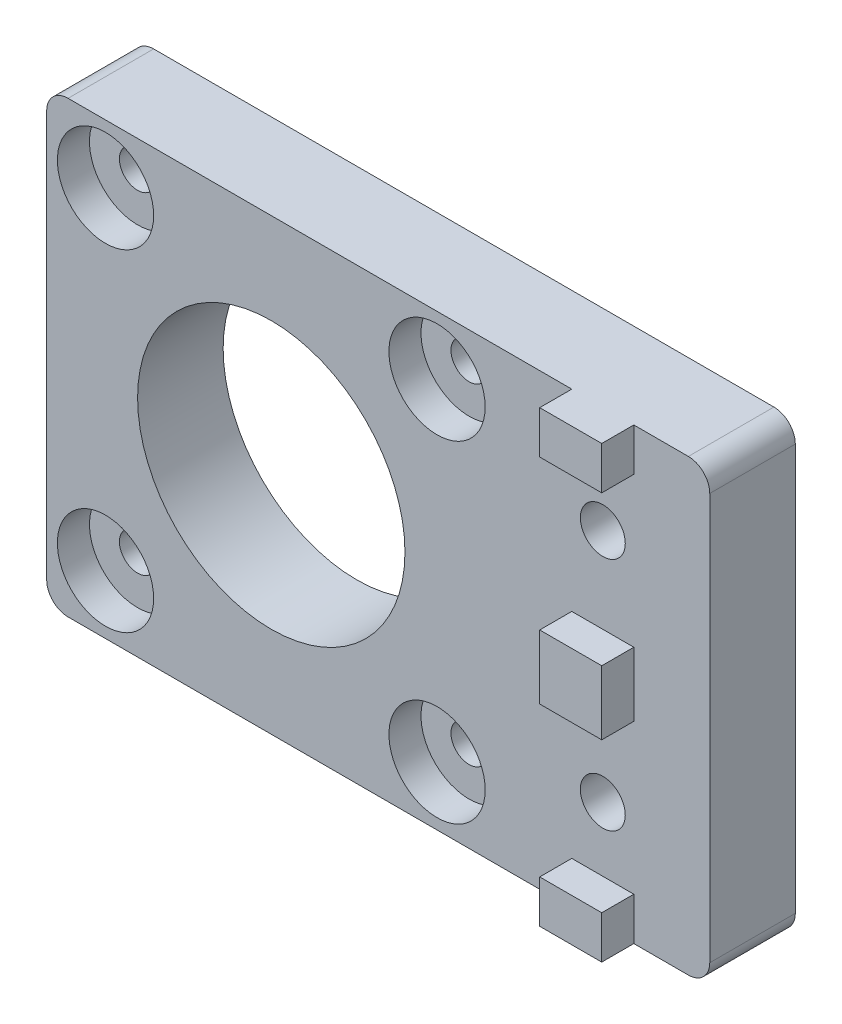
from build123d import *

# Parameters (mm, degrees)
ESQUISSE1_W             = 62
ESQUISSE1_H             = 42
BOSS_EXTRU_1_DEPTH      = 8
ESQUISSE2_R             = 2.1
ESQUISSE2_R_2           = 12.5
ESQUISSE2_R_3           = 1.7
ENL_V_MAT_EXTRU_1_DEPTH = 39.288379438
ESQUISSE3_W             = 5.8
ESQUISSE3_H             = 4
ESQUISSE3_H_2           = 6
BOSS_EXTRU_2_DEPTH      = 3
CONG_1_R                = 2
ESQUISSE4_R             = 4.5
ENL_V_MAT_EXTRU_2_DEPTH = 3


with BuildPart() as part:
    # Esquisse1 → Boss.-Extru.1 (new body)
    with BuildSketch(Plane.XY):
        Rectangle(ESQUISSE1_W, ESQUISSE1_H)
    extrude(amount=BOSS_EXTRU_1_DEPTH)

    # Esquisse2 → Enlèv. mat.-Extru.1 (cut, through all)
    with BuildSketch(Plane.XY.offset(8)):
        with Locations((21, 11)):
            Circle(ESQUISSE2_R)
        with Locations((21, -11)):
            Circle(ESQUISSE2_R)
        with Locations((-10, 0)):
            Circle(ESQUISSE2_R_2)
        with Locations((-25.5, 15.5)):
            Circle(ESQUISSE2_R_3)
        with Locations((5.5, 15.5)):
            Circle(ESQUISSE2_R_3)
        with Locations((5.5, -15.5)):
            Circle(ESQUISSE2_R_3)
        with Locations((-25.5, -15.5)):
            Circle(ESQUISSE2_R_3)
    extrude(amount=-ENL_V_MAT_EXTRU_1_DEPTH, mode=Mode.SUBTRACT)

    # Esquisse3 → Boss.-Extru.2 (add)
    with BuildSketch(Plane.XY.offset(8)):
        with Locations((21, 19)):
            Rectangle(ESQUISSE3_W, ESQUISSE3_H)
        with Locations((21, -19)):
            Rectangle(ESQUISSE3_W, ESQUISSE3_H)
        with Locations((21, 0)):
            Rectangle(ESQUISSE3_W, ESQUISSE3_H_2)
    extrude(amount=BOSS_EXTRU_2_DEPTH)

    # Congé1
    cong_1_edges = [part.edges().sort_by_distance(p)[0] for p in [
        (-31, 21, 4),
        (-31, -21, 4),
        (31, 21, 4),
        (31, -21, 4),
    ]]
    fillet(cong_1_edges, radius=CONG_1_R)

    # Esquisse4 → Enlèv. mat.-Extru.2 (cut)
    with BuildSketch(Plane.XY.offset(8)):
        with Locations((-25.5, 15.5)):
            Circle(ESQUISSE4_R)
        with Locations((-25.5, -15.5)):
            Circle(ESQUISSE4_R)
        with Locations((5.5, -15.5)):
            Circle(ESQUISSE4_R)
        with Locations((5.5, 15.5)):
            Circle(ESQUISSE4_R)
    extrude(amount=-ENL_V_MAT_EXTRU_2_DEPTH, mode=Mode.SUBTRACT)


solid = part.part
